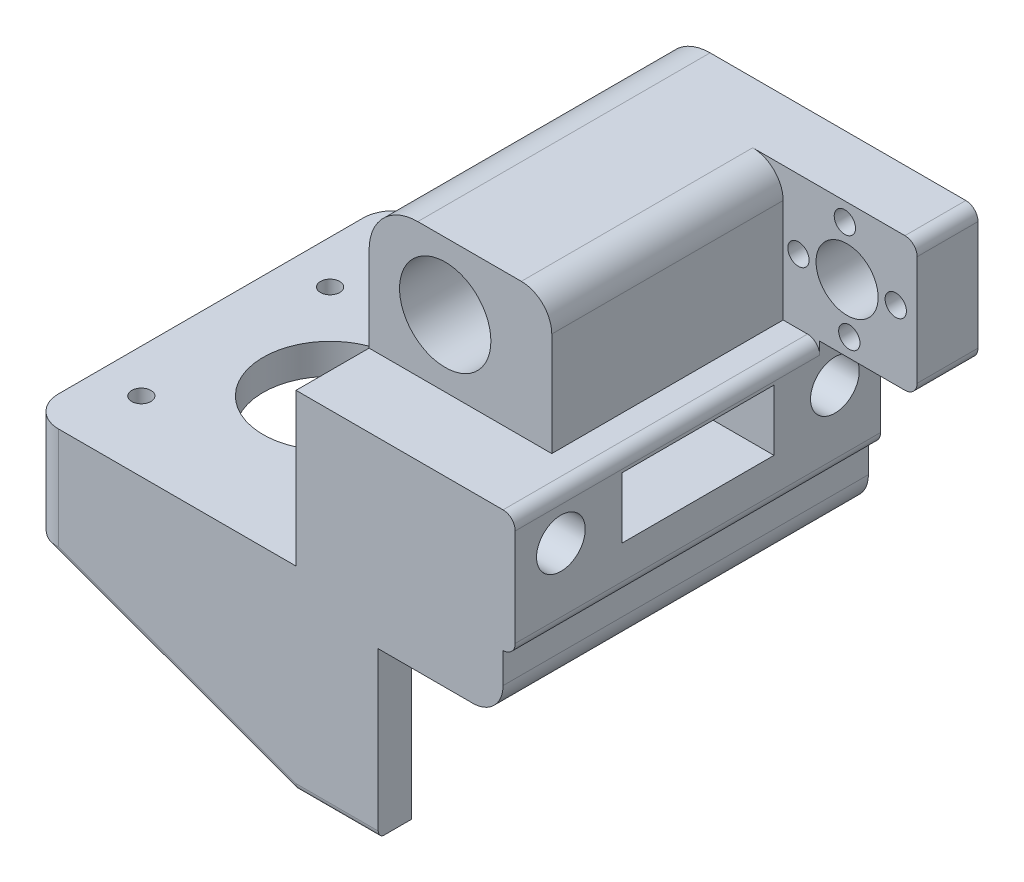
from build123d import *

# Parameters (mm, degrees)
SKETCH_1_W           = 80
SKETCH_1_H           = 60
EXTRUDE_1_DEPTH      = 5
SKETCH_2_R           = 1.75
SKETCH_2_R_2         = 11
CUT_EXTRUDE_1_DEPTH  = 51.249378106
SKETCH_3_W           = 36
SKETCH_3_H           = 60
EXTRUDE_2_DEPTH      = 15
SKETCH_4_R           = 4
SKETCH_4_W           = 25
SKETCH_4_H           = 10
CUT_EXTRUDE_7_DEPTH  = 57.885850613
EXTRUDE_6_DEPTH      = 22
SKETCH_15_R          = 7.5
CUT_EXTRUDE_8_DEPTH  = 85.876380696
SKETCH_16_R          = 5.1
CUT_EXTRUDE_9_DEPTH  = 87.02325267
FILLET_1_R           = 8
FILLET_2_R           = 5
FILLET_3_R           = 2
FILLET_4_R           = 2
SKETCH_20_R          = 1.75
CUT_EXTRUDE_11_DEPTH = 93.195444573
SKETCH_23_W          = 78
SKETCH_23_H          = 60
EXTRUDE_8_DEPTH      = 10
SKETCH_26_W          = 44
SKETCH_26_H          = 60
CUT_EXTRUDE_13_DEPTH = 10
EXTRUDE_9_DEPTH      = 5
FILLET_5_R           = 5
SKETCH_25_R          = 1.581789818
SKETCH_25_R_2        = 11
CUT_EXTRUDE_14_DEPTH = 83.097503007
CUT_EXTRUDE_15_DEPTH = 1.5
EXTRUDE_10_DEPTH     = 2
FILLET_6_R           = 1
CUT_EXTRUDE_16_DEPTH = 83.097503007
EXTRUDE_11_DEPTH     = 13.5


with BuildPart() as part:
    # 草图1 → 凸台-拉伸1 (new body)
    with BuildSketch(Plane(origin=(0, 0, 0), x_dir=(1, 0, 0), z_dir=(0, 1, 0))):
        Rectangle(SKETCH_1_W, SKETCH_1_H)
    extrude(amount=EXTRUDE_1_DEPTH)

    # 草图2 → 切除-拉伸1 (cut, through all)
    with BuildSketch(Plane(origin=(0, 5, 0), x_dir=(1, 0, 0), z_dir=(0, 1, 0))):
        with Locations(Location((-3, 15.5, 0), (0, 0, 270))):
            Circle(SKETCH_2_R)
        with Locations(Location((-3, -15.5, 0), (0, 0, 270))):
            Circle(SKETCH_2_R)
        with Locations(Location((-34, -15.5, 0), (0, 0, 270))):
            Circle(SKETCH_2_R)
        with Locations(Location((-34, 15.5, 0), (0, 0, 270))):
            Circle(SKETCH_2_R)
        with Locations(Location((-18.5, 0, 0), (0, 0, 270))):
            Circle(SKETCH_2_R_2)
    extrude(amount=-CUT_EXTRUDE_1_DEPTH, mode=Mode.SUBTRACT)

    # 草图3 → 凸台-拉伸2 (add)
    with BuildSketch(Plane(origin=(0, 5, 0), x_dir=(1, 0, 0), z_dir=(0, 1, 0))):
        with Locations((22, 0)):
            Rectangle(SKETCH_3_W, SKETCH_3_H)
    extrude(amount=EXTRUDE_2_DEPTH)

    # 草图4 → 切除-拉伸7 (cut, through all)
    with BuildSketch(Plane.ZY.offset(-4)):
        with Locations((-22.5, 12.5)):
            Circle(SKETCH_4_R)
        with Locations((22.5, 12.5)):
            Circle(SKETCH_4_R)
        with Locations((0, 12.5)):
            Rectangle(SKETCH_4_W, SKETCH_4_H)
    extrude(amount=-CUT_EXTRUDE_7_DEPTH, mode=Mode.SUBTRACT)

    # 草图14 → 凸台-拉伸6 (add)
    with BuildSketch(Plane(origin=(0, 20, 0), x_dir=(1, 0, 0), z_dir=(0, 1, 0))):
        Polygon((4, 30), (4, -18), (34, -18), (34, 20), (56, 20), (56, 30), align=None)
    extrude(amount=EXTRUDE_6_DEPTH)

    # 草图15 → 切除-拉伸8 (cut, through all)
    with BuildSketch(Plane.XY.offset(18)):
        with Locations((16.5, 31)):
            Circle(SKETCH_15_R)
    extrude(amount=-CUT_EXTRUDE_8_DEPTH, mode=Mode.SUBTRACT)

    # 草图16 → 切除-拉伸9 (cut, through all)
    with BuildSketch(Plane.XY.offset(-20)):
        with Locations((44.5, 31)):
            Circle(SKETCH_16_R)
    extrude(amount=-CUT_EXTRUDE_9_DEPTH, mode=Mode.SUBTRACT)

    # 圆角1
    fillet_1_edges = [part.edges().sort_by_distance(p)[0] for p in [
        (4, 42, -6),
    ]]
    fillet(fillet_1_edges, radius=FILLET_1_R)

    # 圆角2
    fillet_2_edges = [part.edges().sort_by_distance(p)[0] for p in [
        (34, 42, -1),
    ]]
    fillet(fillet_2_edges, radius=FILLET_2_R)

    # 圆角3
    fillet_3_edges = [part.edges().sort_by_distance(p)[0] for p in [
        (56, 42, -25),
    ]]
    fillet(fillet_3_edges, radius=FILLET_3_R)

    # 圆角4
    fillet_4_edges = [part.edges().sort_by_distance(p)[0] for p in [
        (40, 20, 5),
        (40, 0, 0),
        (56, 20, -25),
    ]]
    fillet(fillet_4_edges, radius=FILLET_4_R)

    # 草图20 → 切除-拉伸11 (cut, through all)
    with BuildSketch(Plane(origin=(0, 0, -30), x_dir=(-1, 0, 0), z_dir=(0, 0, -1))):
        with Locations((-44.135340411, 38.99168464)):
            Circle(SKETCH_20_R)
        with Locations((-36.50831536, 30.635340412)):
            Circle(SKETCH_20_R)
        with Locations((-44.864659589, 23.00831536)):
            Circle(SKETCH_20_R)
        with Locations((-52.49168464, 31.364659589)):
            Circle(SKETCH_20_R)
    extrude(amount=-CUT_EXTRUDE_11_DEPTH, mode=Mode.SUBTRACT)

    # 草图23 → 凸台-拉伸8 (add)
    with BuildSketch(Plane.XZ):
        with Locations((-1, 0)):
            Rectangle(SKETCH_23_W, SKETCH_23_H)
    extrude(amount=EXTRUDE_8_DEPTH)

    # 草图26 → 切除-拉伸13 (cut)
    with BuildSketch(Plane(origin=(0, 5, 0), x_dir=(1, 0, 0), z_dir=(0, 1, 0))):
        with Locations((-18, 0)):
            Rectangle(SKETCH_26_W, SKETCH_26_H)
    extrude(amount=-CUT_EXTRUDE_13_DEPTH, mode=Mode.SUBTRACT)

    # 草图29 → 凸台-拉伸9 (add)
    with BuildSketch(Plane.XY.offset(23)):
        Polygon((-40, -5), (-40, -21), (4, -37), (4, -5), align=None)
    extrude(amount=EXTRUDE_9_DEPTH)

    # 圆角5
    fillet_5_edges = [part.edges().sort_by_distance(p)[0] for p in [
        (38, -10, 0),
        (-40, -7.5, 30),
        (-40, -7.5, -30),
    ]]
    fillet(fillet_5_edges, radius=FILLET_5_R)

    # 草图25 → 切除-拉伸14 (cut, through all)
    with BuildSketch(Plane.XZ.offset(10)):
        with Locations(Location((-32.902220535, -12.494692857, 0), (0, 0, 270))):
            Circle(SKETCH_25_R)
        with Locations(Location((-1.902220535, 18.505307143, 0), (0, 0, 270))):
            Circle(SKETCH_25_R)
        with Locations(Location((-32.902220535, 18.505307143, 0), (0, 0, 270))):
            Circle(SKETCH_25_R)
        with Locations(Location((-1.902220535, -12.494692857, 0), (0, 0, 270))):
            Circle(SKETCH_25_R)
        with Locations(Location((-17.402220535, 3.005307143, 0), (0, 0, 270))):
            Circle(SKETCH_25_R_2)
    extrude(amount=-CUT_EXTRUDE_14_DEPTH, mode=Mode.SUBTRACT)

    # 草图30 → 切除-拉伸15 (cut)
    with BuildSketch(Plane(origin=(0, 0, 23), x_dir=(-1, 0, 0), z_dir=(0, 0, -1))):
        Polygon((-4, -10), (40, -10), (40, -21), (-4, -37), align=None)
    extrude(amount=-CUT_EXTRUDE_15_DEPTH, mode=Mode.SUBTRACT)

    # 草图31 → 凸台-拉伸10 (add)
    with BuildSketch(Plane.XY.offset(28)):
        Polygon((-39.701600618, -21.108508866), (-39.701600618, -10), (4, -10), (4, -37), align=None)
    extrude(amount=EXTRUDE_10_DEPTH)

    # 圆角6
    # the kernel refuses this fillet: 1 mm, written as the material it takes off along each edge
    with BuildSketch(Plane(origin=(-40, -10, 24.5), x_dir=(1, 0, 0), z_dir=(0, -1, 0))) as fillet_6_piece_1:
        with BuildLine():
            CenterArc((1.031373033, 1), FILLET_6_R, 172.819244219, 97.180755781)
            Line((0.039216292, 1.125), (-0.059999382, 1.1375))
            ThreePointArc((-0.059999382, 1.1375), (-0.1, 0.5), (-0.1, 0))
            Line((-0.1, 0), (0, -0.1))
            Line((0, -0.1), (1.031373033, -0.1))
            Line((1.031373033, -0.1), (1.031373033, 0))
        make_face()
    extrude(amount=13.814208278, mode=Mode.SUBTRACT)
    with BuildSketch(Plane(origin=(6.349483559, -37.854357658, 30), x_dir=(0.34174306308670427, 0.9397934234884371, 0), z_dir=(-0.9397934234884371, 0.3417430630867043, 0))) as fillet_6_piece_2:
        with BuildLine():
            CenterArc((FILLET_6_R, FILLET_6_R), FILLET_6_R, 180, 90)
            Line((0, FILLET_6_R), (-FILLET_6_R * 0.02, FILLET_6_R))
            Line((-FILLET_6_R * 0.02, FILLET_6_R), (-FILLET_6_R * 0.02, -FILLET_6_R * 0.02))
            Line((-FILLET_6_R * 0.02, -FILLET_6_R * 0.02), (FILLET_6_R, -FILLET_6_R * 0.02))
            Line((FILLET_6_R, -FILLET_6_R * 0.02), (FILLET_6_R, 0))
        make_face()
    extrude(amount=51.501283714, mode=Mode.SUBTRACT)
    with BuildSketch(Plane(origin=(-39.701600618, -23.49461161, 28), x_dir=(1, 0, 0), z_dir=(0, 1, 0))) as fillet_6_piece_3_section:
        with BuildLine():
            CenterArc((1, -0.954441098), FILLET_6_R, 107.361491651, 72.638508349)
            Line((0, -0.954441098), (-0.02, -0.954441098))
            Line((-0.02, -0.954441098), (-0.02, 0))
            Line((-0.02, 0), (0, 0.02))
            ThreePointArc((0, 0.02), (0.350800309, 0.02), (0.69563263, 0.019088822))
            Line((0.69563263, 0.019088822), (0.701600618, 0))
        make_face()
    fillet_6_piece_3 = extrude(amount=15.880714354, mode=Mode.PRIVATE)
    fillet_6_piece_3 = fillet_6_piece_3 - Plane(origin=(-35, -15.554254433, 25), x_dir=(0, 0, 1), z_dir=(0, -1, 0)) * Cylinder(5, 36, mode=Mode.PRIVATE)
    add(fillet_6_piece_3, mode=Mode.SUBTRACT)
    with BuildSketch(Plane(origin=(-39.701600618, -23.608508866, 30), x_dir=(1, 0, 0), z_dir=(0, 1, 0))) as fillet_6_piece_4:
        with BuildLine():
            CenterArc((FILLET_6_R, FILLET_6_R), FILLET_6_R, 180, 90)
            Line((0, FILLET_6_R), (-FILLET_6_R * 0.02, FILLET_6_R))
            Line((-FILLET_6_R * 0.02, FILLET_6_R), (-FILLET_6_R * 0.02, -FILLET_6_R * 0.02))
            Line((-FILLET_6_R * 0.02, -FILLET_6_R * 0.02), (FILLET_6_R, -FILLET_6_R * 0.02))
            Line((FILLET_6_R, -FILLET_6_R * 0.02), (FILLET_6_R, 0))
        make_face()
    extrude(amount=16.108508866, mode=Mode.SUBTRACT)

    # 草图32 → 切除-拉伸16 (cut, through all)
    with BuildSketch(Plane(origin=(0, -10, 0), x_dir=(1, 0, 0), z_dir=(0, 1, 0))):
        with BuildLine():
            Line((-39.701600618, -28.954441098), (-39.701600618, -29))
            ThreePointArc((-39.701600618, -29), (-39.408707399, -29.707106781), (-38.701600618, -30))
            Line((-38.701600618, -30), (-35, -30))
            ThreePointArc((-35, -30), (-37.236067977, -29.472135955), (-39, -28))
            ThreePointArc((-39, -28), (-39.507329909, -28.362157121), (-39.701600618, -28.954441098))
        make_face()
    extrude(amount=-CUT_EXTRUDE_16_DEPTH, mode=Mode.SUBTRACT)

    # 草图33 → 凸台-拉伸11 (add)
    with BuildSketch(Plane(origin=(4, 0, 0), x_dir=(0, 0, -1), z_dir=(1, 0, 0))):
        with BuildLine():
            Line((-30, -10), (-30, -35.935936372))
            add(Edge.make_bspline(
                [(-30, -35.935936372), (-30, -37), (-29, -37)],
                knots=[1.570796327, 1.570796327, 1.570796327, 3.141592654, 3.141592654, 3.141592654], degree=2, weights=[1, 0.707106781, 1]))
            Line((-29, -37), (-24.5, -37))
            Line((-24.5, -37), (-24.5, -10))
            Line((-24.5, -10), (-30, -10))
        make_face()
    extrude(amount=EXTRUDE_11_DEPTH)


solid = part.part
